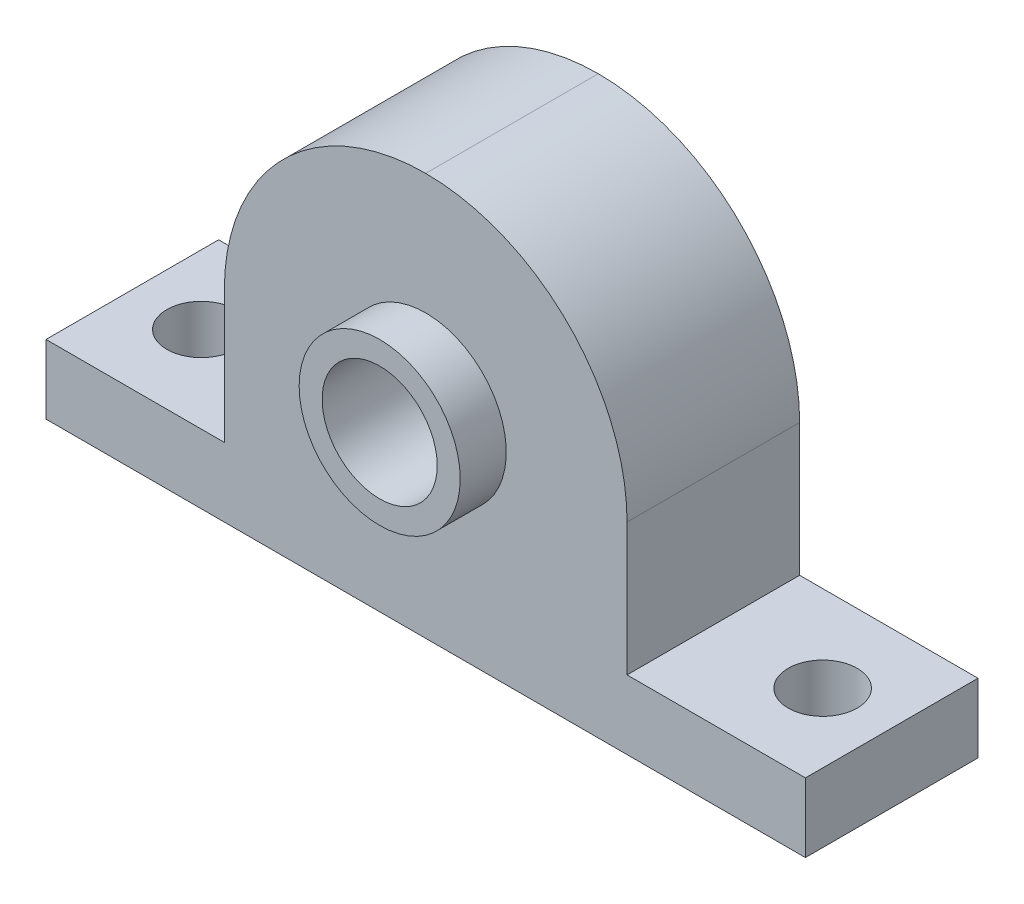
from build123d import *

# Parameters (mm, degrees)
SKETCH1_W           = 66
SKETCH1_H           = 15
BOSS_EXTRUDE1_DEPTH = 6
SKETCH2_W           = 35
SKETCH2_H           = 15
BOSS_EXTRUDE2_DEPTH = 29
FILLET1_R           = 17.5
SKETCH3_R           = 7
BOSS_EXTRUDE3_DEPTH = 4
SKETCH4_R           = 5
CUT_EXTRUDE1_DEPTH  = 52.720402164
SKETCH5_R           = 3
CUT_EXTRUDE2_DEPTH  = 46.412002819


with BuildPart() as part:
    # Sketch1 → Boss-Extrude1 (new body)
    with BuildSketch(Plane(origin=(0, 0, 0), x_dir=(1, 0, 0), z_dir=(0, 1, 0))):
        Rectangle(SKETCH1_W, SKETCH1_H)
    extrude(amount=BOSS_EXTRUDE1_DEPTH)

    # Sketch2 → Boss-Extrude2 (add)
    with BuildSketch(Plane(origin=(0, 6, 0), x_dir=(1, 0, 0), z_dir=(0, 1, 0))):
        Rectangle(SKETCH2_W, SKETCH2_H)
    extrude(amount=BOSS_EXTRUDE2_DEPTH)

    # Fillet1
    fillet1_edges = [part.edges().sort_by_distance(p)[0] for p in [
        (17.5, 35, 0),
        (-17.5, 35, 0),
    ]]
    fillet(fillet1_edges, radius=FILLET1_R - 0.0001)  # a hair under: the kernel refuses the full size

    # Sketch3 → Boss-Extrude3 (add)
    with BuildSketch(Plane.XY.offset(7.5)):
        with Locations(Location((0, 17.5, 0), (0, 0, 180))):
            Circle(SKETCH3_R)
    extrude(amount=BOSS_EXTRUDE3_DEPTH)

    # Sketch4 → Cut-Extrude1 (cut, through all)
    with BuildSketch(Plane.XY.offset(11.5)):
        with Locations((0, 17.5)):
            Circle(SKETCH4_R)
    extrude(amount=-CUT_EXTRUDE1_DEPTH, mode=Mode.SUBTRACT)

    # Sketch5 → Cut-Extrude2 (cut, through all)
    with BuildSketch(Plane(origin=(0, 6, 0), x_dir=(1, 0, 0), z_dir=(0, 1, 0))):
        with Locations(Location((-27, 0, 0), (0, 0, 270))):
            Circle(SKETCH5_R)
    cut_extrude2 = extrude(amount=-CUT_EXTRUDE2_DEPTH, mode=Mode.SUBTRACT)

    # Mirror1: Cut-Extrude2 across plane
    add(cut_extrude2.mirror(Plane(origin=(0, 0, 0), x_dir=(0, 0, 1), z_dir=(1, 0, 0))), mode=Mode.SUBTRACT)


solid = part.part
